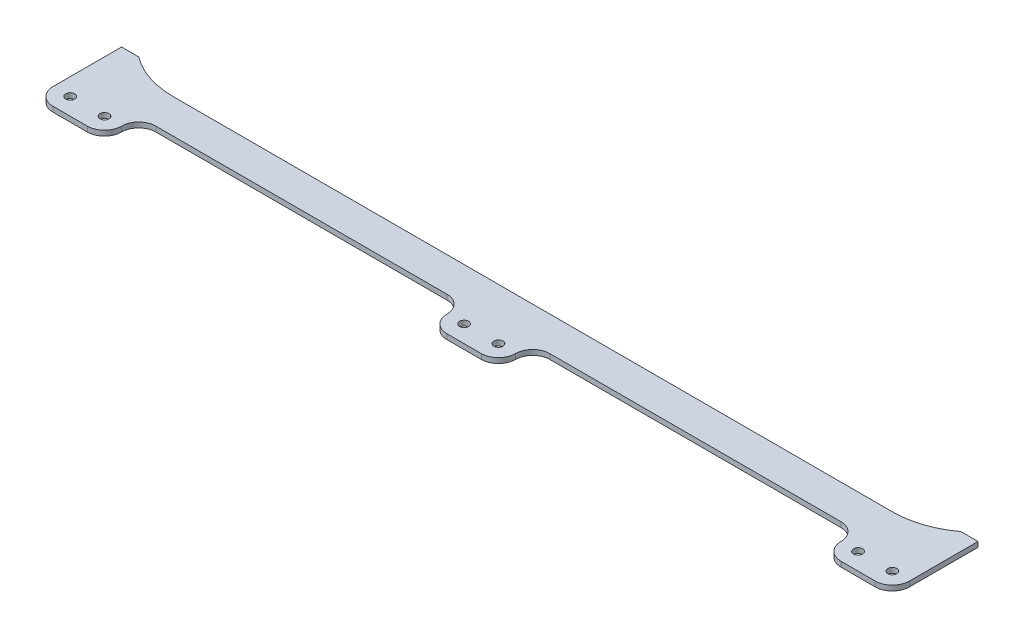
from build123d import *

# Parameters (mm, degrees)
EXTRUDE_1_DEPTH        = 3
SKETCH_2_W             = 40
SKETCH_2_H             = 20
EXTRUDE_2_DEPTH        = 3
HOLE_WIZARD_M51_D      = 5.3
PATTERN_LINEAR_1_COUNT = 3
PATTERN_LINEAR_1_PITCH = 230
FILLET_1_R             = 10


with BuildPart() as part:
    # Эскиз1 → Бобышка-Вытянуть1 (new body)
    with BuildSketch(Plane(origin=(0, 0, 0), x_dir=(1, 0, 0), z_dir=(0, 1, 0))):
        with BuildLine():
            Line((210, 5), (-210, 5))
            ThreePointArc((-210, 5), (-225.811388301, 7.565835097), (-240, 15))
            Line((-240, 15), (-250, 15))
            Line((-250, 15), (-250, -15))
            Line((-250, -15), (250, -15))
            Line((250, -15), (250, 15))
            Line((250, 15), (240, 15))
            ThreePointArc((240, 15), (225.811388301, 7.565835097), (210, 5))
        make_face()
    extrude(amount=EXTRUDE_1_DEPTH)

    # Эскиз2 → Бобышка-Вытянуть2 (add)
    with BuildSketch(Plane(origin=(0, 3, 0), x_dir=(1, 0, 0), z_dir=(0, 1, 0))):
        with Locations((230, -25)):
            Rectangle(SKETCH_2_W, SKETCH_2_H)
    extrude_2 = extrude(amount=-EXTRUDE_2_DEPTH)

    # Отверстие с зазором M51 (through all)
    with Locations(Plane(origin=(0, 3, 0), x_dir=(1, 0, 0), z_dir=(0, 1, 0))):
        with Locations((220, -25), (240, -25)):
            hole_wizard_m51 = Hole(HOLE_WIZARD_M51_D / 2)

    # Линейный массив1: Бобышка-Вытянуть2, Отверстие с зазором M51 ×3
    with Locations(*[(-i * PATTERN_LINEAR_1_PITCH, 0, 0) for i in range(1, PATTERN_LINEAR_1_COUNT)]):
        add(extrude_2)
        add(hole_wizard_m51, mode=Mode.SUBTRACT)

    # Скругление1
    fillet_1_edges = [part.edges().sort_by_distance(p)[0] for p in [
        (-250, 1.5, 35),
        (-210, 1.5, 35),
        (-210, 1.5, 15),
        (-20, 1.5, 15),
        (-20, 1.5, 35),
        (20, 1.5, 35),
        (20, 1.5, 15),
        (210, 1.5, 15),
        (250, 1.5, 35),
        (210, 1.5, 35),
    ]]
    fillet(fillet_1_edges, radius=FILLET_1_R - 0.0001)  # a hair under: the kernel refuses the full size


solid = part.part
